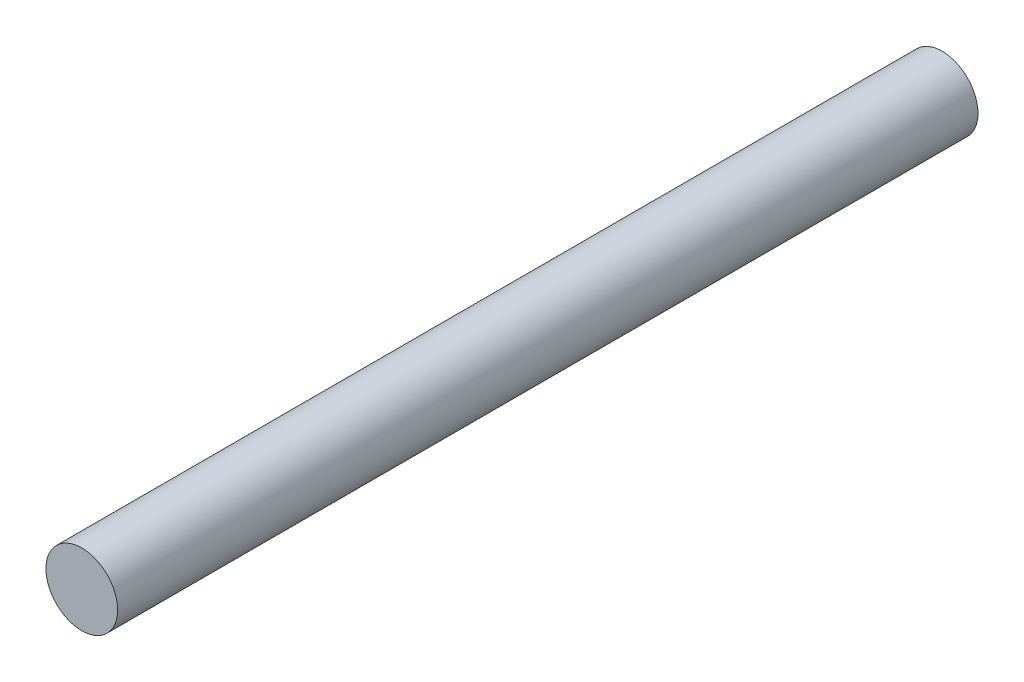
from build123d import *

# Parameters (mm, degrees)
SKETCH1_R           = 3
BOSS_EXTRUDE1_DEPTH = 72


with BuildPart() as part:
    # Sketch1 → Boss-Extrude1 (new body)
    with BuildSketch(Plane.XY):
        Circle(SKETCH1_R)
    extrude(amount=BOSS_EXTRUDE1_DEPTH)


solid = part.part
